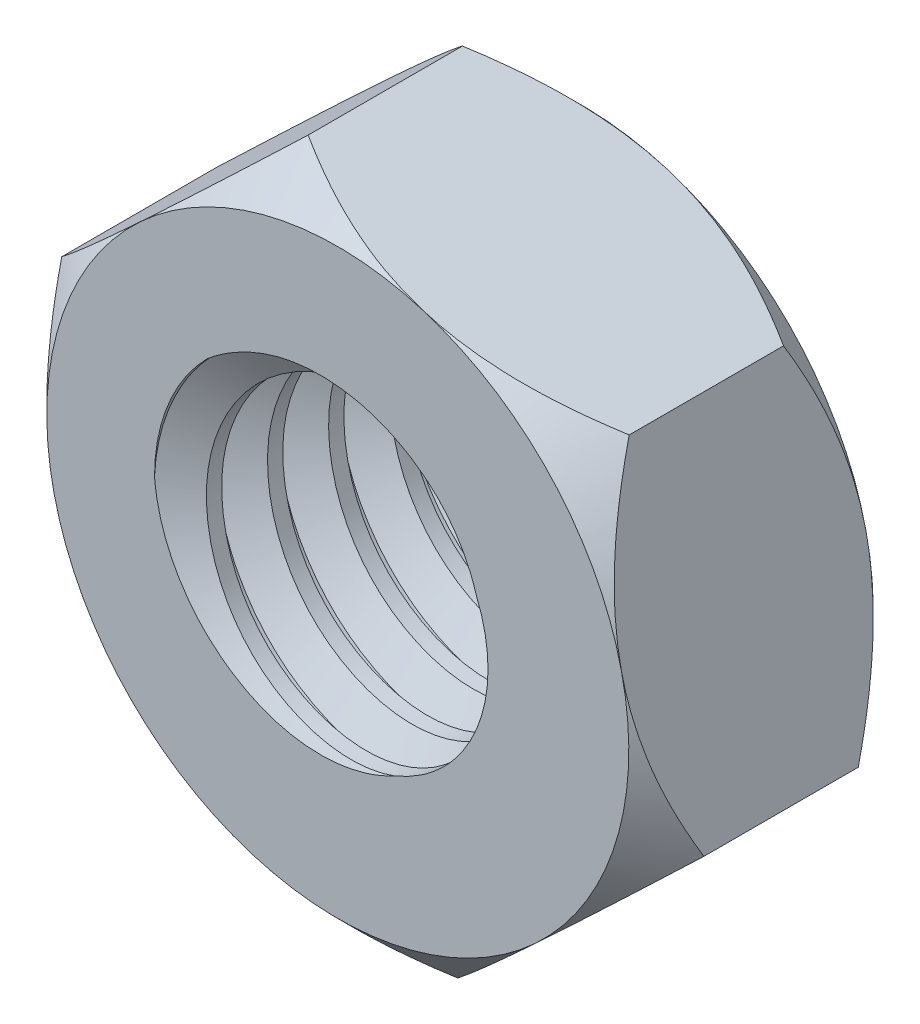
from build123d import *

# Parameters (mm, degrees)
BOSS_EXTRUDE1_DEPTH      = 1
BOSS_EXTRUDE1_DEPTH_BACK = 1
CUT_EXTRUDE1_REACH       = 6.254
SKETCH2_R                = 1.5
THREAD3_PITCH            = 0.5
SKETCH17_R               = 1.788786738
CUT_EXTRUDE5_DEPTH       = 1
SKETCH18_R               = 1.951796418
CUT_EXTRUDE6_DEPTH       = 5.253705964
SKETCH19_OUTSIDE_W       = 10.31
SKETCH19_OUTSIDE_H       = 10.416
SKETCH19_OUTSIDE_R       = 2.38156986
CUT_EXTRUDE7_DEPTH       = 0.75
CUT_EXTRUDE7_DRAFT       = -45
MIRROR1_COPY_1_SKETCH_W  = 10.31
MIRROR1_COPY_1_SKETCH_H  = 10.416
MIRROR1_COPY_1_SKETCH_R  = 2.38156986
MIRROR1_COPY_1_DEPTH     = 0.75
MIRROR1_COPY_1_DRAFT     = -45


with BuildPart() as part:
    # Sketch1 → Boss-Extrude1 (new, two sides: drawn at the far end of the back side and taken through both)
    with BuildSketch(Plane.XY.offset(-BOSS_EXTRUDE1_DEPTH_BACK)):
        Polygon((2.627673365, -0.811068855), (2.016242915, 1.87009746), (-0.61143045, 2.681166314), (-2.627673365, 0.811068855), (-2.016242915, -1.87009746), (0.61143045, -2.681166314), align=None)
    extrude(amount=BOSS_EXTRUDE1_DEPTH + BOSS_EXTRUDE1_DEPTH_BACK)

    # Sketch2 → Cut-Extrude1 (cut, up to next)
    with BuildSketch(Plane.XY.offset(1), mode=Mode.PRIVATE) as cut_extrude1_sk1:
        Circle(SKETCH2_R)
    cut_extrude1_tool1 = extrude(cut_extrude1_sk1.sketch, amount=-CUT_EXTRUDE1_REACH, mode=Mode.PRIVATE) & part.part
    add(cut_extrude1_tool1.solids().sort_by_distance((0, 0, 1))[0], mode=Mode.SUBTRACT)

    # Thread3: the profile of Thread Profile3 profile screwed along a right-hand helix of 8 turns, 6 arcs to a turn; built about Z, then put on its axis
    thread3_z = Axis((0, 0, 0), (0, 0, 1))
    thread3_corners = [(1.5003, 0, -0.000173205), (1.5003, 0, 0.437673204), (1.229367063, 0, 0.281249999), (1.229367063, 0, 0.156249999)]
    with BuildLine(mode=Mode.PRIVATE) as thread3_profile:
        Line(thread3_corners[0], thread3_corners[1])
        Line(thread3_corners[1], thread3_corners[2])
        Line(thread3_corners[2], thread3_corners[3])
        Line(thread3_corners[3], thread3_corners[0])
    thread3_cap = Face(thread3_profile.wire())
    thread3_turn_angles = [0, 30, 60, 90, 120, 150, 180, 210, 240, 270, 300, 330, 360]
    thread3_turn_weights = [1, 0.8660254037844387, 1, 0.8660254037844387, 1, 0.8660254037844387, 1, 0.8660254037844387, 1, 0.8660254037844387, 1, 0.8660254037844387, 1]
    thread3_turn_rails = [Edge.make_bspline([Vector(p[0], p[1], 0).rotate(thread3_z, thread3_turn_angles[k]) / thread3_turn_weights[k] + Vector(0, 0, p[2] + THREAD3_PITCH * thread3_turn_angles[k] / 360) for k in range(13)], [0, 0, 0, 1, 1, 2, 2, 3, 3, 4, 4, 5, 5, 6, 6, 6], 2, thread3_turn_weights) for p in thread3_corners]
    thread3_turn_sides = [Face.make_surface_from_curves(thread3_turn_rails[p[0]], thread3_turn_rails[p[1]]) for p in [(0, 1), (1, 2), (2, 3), (3, 0)]]
    thread3 = Plane(origin=(0, 0, 3), x_dir=(-1, 0, 0), z_dir=(0, 0, -1)) * Solid(Shell([*[p.moved(Location((0, 0, THREAD3_PITCH * i))) for i in range(8) for p in thread3_turn_sides], thread3_cap, thread3_cap.rotate(thread3_z, 2880).moved(Location((0, 0, THREAD3_PITCH * 2880 / 360)))]))
    add(thread3)

    # Sketch17 → Cut-Extrude5 (cut)
    with BuildSketch(Plane(origin=(0, 0, -1), x_dir=(-1, 0, 0), z_dir=(0, 0, -1))):
        Circle(SKETCH17_R)
    extrude(amount=CUT_EXTRUDE5_DEPTH, mode=Mode.SUBTRACT)

    # Sketch18 → Cut-Extrude6 (cut, through all)
    with BuildSketch(Plane.XY.offset(1)):
        Circle(SKETCH18_R)
    extrude(amount=CUT_EXTRUDE6_DEPTH, mode=Mode.SUBTRACT)


with BuildPart() as cut_extrude7_tool:
    # Sketch19 outside → Cut-Extrude7 (with draft: the straight prism first)
    with BuildSketch(Plane.XY.offset(1)):
        Rectangle(SKETCH19_OUTSIDE_W, SKETCH19_OUTSIDE_H)
        Circle(SKETCH19_OUTSIDE_R, mode=Mode.SUBTRACT)
    extrude(amount=-CUT_EXTRUDE7_DEPTH)
    # Cut-Extrude7: the draft: its side faces are tilted about the plane it starts from
    cut_extrude7_sides = [cut_extrude7_tool.faces().sort_by_distance(p)[0] for p in [
        (0, -5.208, 0.625),
        (5.155, 0, 0.625),
        (0, 5.208, 0.625),
        (-5.155, 0, 0.625),
        (-2.38156986, 0, 0.625),
    ]]
    draft(cut_extrude7_sides, Plane.XY.offset(1), CUT_EXTRUDE7_DRAFT)


with BuildPart() as part_1:
    add(part.part)

    # Cut-Extrude7: cut by cut_extrude7_tool
    add(cut_extrude7_tool.part, mode=Mode.SUBTRACT)


with BuildPart() as mirror1_copy_1_tool:
    # Mirror1 copy 1 sketch → Mirror1 copy 1 (with draft: the straight prism first)
    with BuildSketch(Plane(origin=(0, 0, -1), x_dir=(1, 0, 0), z_dir=(0, 0, -1))):
        Rectangle(MIRROR1_COPY_1_SKETCH_W, MIRROR1_COPY_1_SKETCH_H)
        Circle(MIRROR1_COPY_1_SKETCH_R, mode=Mode.SUBTRACT)
    extrude(amount=-MIRROR1_COPY_1_DEPTH)
    # Mirror1 copy 1: the draft: its side faces are tilted about the plane it starts from
    mirror1_copy_1_sides = [mirror1_copy_1_tool.faces().sort_by_distance(p)[0] for p in [
        (0, -5.208, -0.625),
        (5.155, 0, -0.625),
        (0, 5.208, -0.625),
        (-5.155, 0, -0.625),
        (-2.38156986, 0, -0.625),
    ]]
    draft(mirror1_copy_1_sides, Plane(origin=(0, 0, -1), x_dir=(1, 0, 0), z_dir=(0, 0, -1)), MIRROR1_COPY_1_DRAFT)


with BuildPart() as part_2:
    add(part_1.part)

    # Mirror1 copy 1: cut by mirror1_copy_1_tool
    add(mirror1_copy_1_tool.part, mode=Mode.SUBTRACT)


solid = part_2.part
